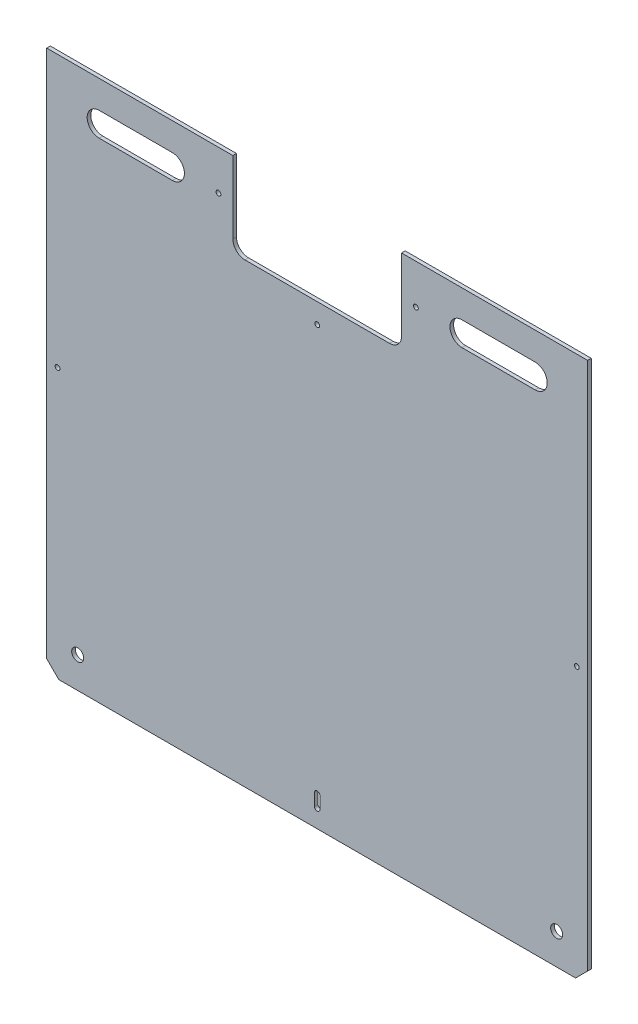
from build123d import *

# Parameters (mm, degrees)
SCHIZZO1_R                   = 2
SCHIZZO1_R_2                 = 5
ESTRUSIONE_ESTRUSIONE1_DEPTH = 3


with BuildPart() as part:
    # Schizzo1 → Estrusione-Estrusione1 (new body)
    with BuildSketch(Plane.XY):
        with BuildLine():
            Line((0, 10), (0, 449))
            Line((0, 449), (154.5, 449))
            Line((154.5, 449), (154.5, 389))
            ThreePointArc((154.5, 389), (157.428932188, 381.928932188), (164.5, 379))
            Line((164.5, 379), (284.5, 379))
            ThreePointArc((284.5, 379), (291.571067812, 381.928932188), (294.5, 389))
            Line((294.5, 389), (294.5, 449))
            Line((294.5, 449), (449, 449))
            Line((449, 449), (449, 10))
            Line((449, 10), (439, 0))
            Line((439, 0), (10, 0))
            Line((10, 0), (0, 10))
        make_face()
        with Locations((142.566643834, 415.9997554)):
            Circle(SCHIZZO1_R, mode=Mode.SUBTRACT)
        with Locations((224.5, 362.449018035)):
            Circle(SCHIZZO1_R, mode=Mode.SUBTRACT)
        with Locations((306.433356166, 415.9997554)):
            Circle(SCHIZZO1_R, mode=Mode.SUBTRACT)
        with Locations((9, 223.826386399)):
            Circle(SCHIZZO1_R, mode=Mode.SUBTRACT)
        with Locations((440, 224.5)):
            Circle(SCHIZZO1_R, mode=Mode.SUBTRACT)
        with Locations((25.702490096, 25.702490096)):
            Circle(SCHIZZO1_R_2, mode=Mode.SUBTRACT)
        with Locations((423.297509904, 25.702490096)):
            Circle(SCHIZZO1_R_2, mode=Mode.SUBTRACT)
        with BuildLine():
            Line((344.715899345, 425.9997554), (405.440355678, 425.9997554))
            ThreePointArc((405.440355678, 425.9997554), (415.440355678, 415.9997554), (405.440355678, 405.9997554))
            Line((405.440355678, 405.9997554), (344.715899345, 405.9997554))
            ThreePointArc((344.715899345, 405.9997554), (334.715899345, 415.9997554), (344.715899345, 425.9997554))
        make_face(mode=Mode.SUBTRACT)
        with BuildLine():
            Line((104.284100655, 425.9997554), (43.559644322, 425.9997554))
            ThreePointArc((43.559644322, 425.9997554), (33.559644322, 415.9997554), (43.559644322, 405.9997554))
            Line((43.559644322, 405.9997554), (104.284100655, 405.9997554))
            ThreePointArc((104.284100655, 405.9997554), (114.284100655, 415.9997554), (104.284100655, 425.9997554))
        make_face(mode=Mode.SUBTRACT)
        with BuildLine():
            Line((222.25, 15), (222.25, 25))
            ThreePointArc((222.25, 25), (224.5, 27.25), (226.75, 25))
            Line((226.75, 25), (226.75, 15))
            ThreePointArc((226.75, 15), (224.5, 12.75), (222.25, 15))
        make_face(mode=Mode.SUBTRACT)
    extrude(amount=ESTRUSIONE_ESTRUSIONE1_DEPTH)


solid = part.part
